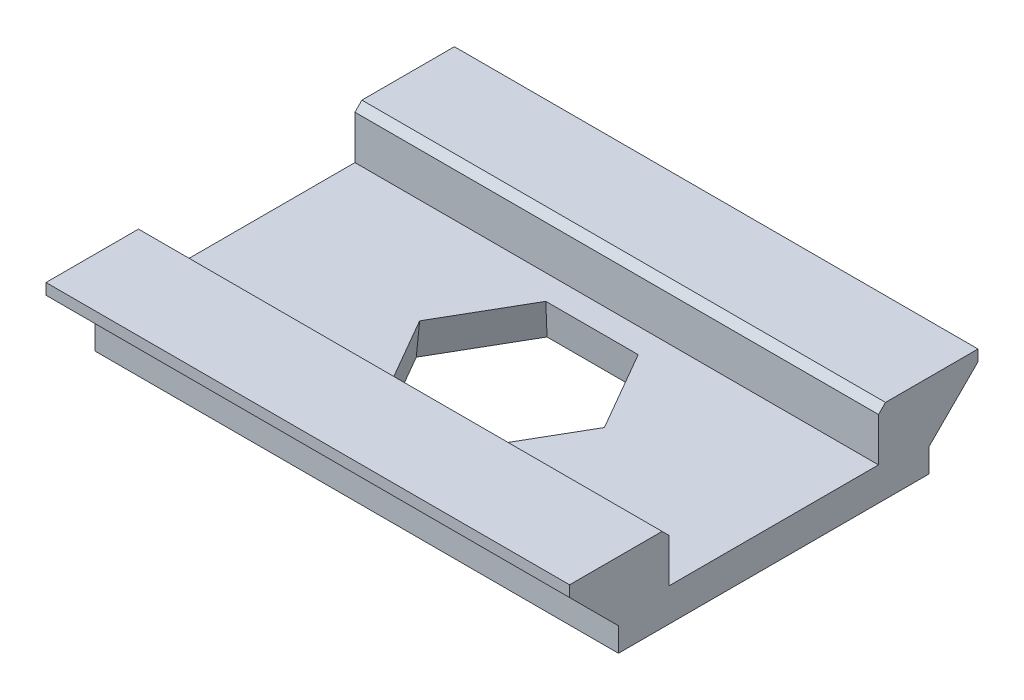
from build123d import *

# Parameters (mm, degrees)
BOSS_EXTRUDE1_DEPTH = 7.5
CUT_EXTRUDE2_DEPTH  = 10.809816512
CUT_EXTRUDE2_DRAFT  = 5
CHAMFER1_SIZE       = 0.2


with BuildPart() as part:
    # Retainer Profile → Boss-Extrude1 (new, symmetric)
    with BuildSketch(Plane(origin=(0, 0, 0), x_dir=(0, 0, -1), z_dir=(1, 0, 0))):
        Polygon((-5.05, 4.792304845), (-5.85, 4.792304845), (-5.85, 4.475147558), (-4.45, 3.075147558), (-4.45, 2.392304845), (4.45, 2.392304845), (4.45, 3.075147558), (5.85, 4.475147558), (5.85, 4.792304845), (5.05, 4.792304845), (3, 4.792304845), (3, 3.342304845), (-3, 3.342304845), (-3, 4.792304845), align=None)
    extrude(amount=BOSS_EXTRUDE1_DEPTH, both=True)


with BuildPart() as cut_extrude2_tool:
    # Sketch3 → Cut-Extrude2 (with draft: the straight prism first)
    with BuildSketch(Plane(origin=(0, 4.792304845, 0), x_dir=(1, 0, 0), z_dir=(0, 1, 0))):
        Polygon((2.5, 0), (1.25, 2.165063509), (-1.25, 2.165063509), (-2.5, 0), (-1.25, -2.165063509), (1.25, -2.165063509), align=None)
    extrude(amount=-CUT_EXTRUDE2_DEPTH)
    # Cut-Extrude2: the draft: its side faces are tilted about the plane it starts from
    cut_extrude2_sides = [cut_extrude2_tool.faces().sort_by_distance(p)[0] for p in [
        (1.875, -0.612603411, -1.082531755),
        (0, -0.612603411, -2.165063509),
        (-1.875, -0.612603411, -1.082531755),
        (-1.875, -0.612603411, 1.082531755),
        (0, -0.612603411, 2.165063509),
        (1.875, -0.612603411, 1.082531755),
    ]]
    draft(cut_extrude2_sides, Plane(origin=(0, 4.792304845, 0), x_dir=(1, 0, 0), z_dir=(0, 1, 0)), CUT_EXTRUDE2_DRAFT)


with BuildPart() as part_1:
    add(part.part)

    # Cut-Extrude2: cut by cut_extrude2_tool
    add(cut_extrude2_tool.part, mode=Mode.SUBTRACT)

    # Chamfer1
    chamfer1_edges = [part_1.edges().sort_by_distance(p)[0] for p in [
        (0, 4.792304845, 3),
        (0, 4.792304845, -3),
    ]]
    chamfer(chamfer1_edges, length=CHAMFER1_SIZE)


solid = part_1.part
